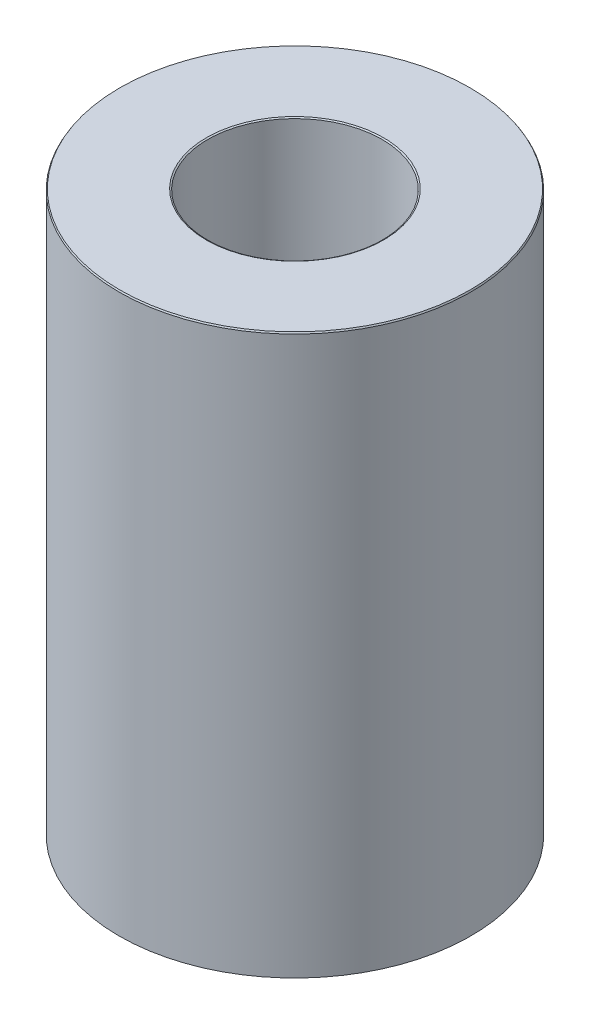
from build123d import *
from OCP.BRepFilletAPI import BRepFilletAPI_MakeChamfer

# Parameters (mm, degrees)
SKETCH1_R           = 57.5
BOSS_EXTRUDE1_DEPTH = 182.991904565
SKETCH2_R           = 28.514841787
CUT_EXTRUDE1_DEPTH  = 201.246191315
CHAMFER1_SIZE       = 0.456871632
CHAMFER1_SIZE2      = 0.267256286


with BuildPart() as part:
    # Sketch1 → Boss-Extrude1 (new body)
    with BuildSketch(Plane(origin=(0, 0, 0), x_dir=(1, 0, 0), z_dir=(0, 1, 0))):
        Circle(SKETCH1_R)
    extrude(amount=BOSS_EXTRUDE1_DEPTH)

    # Sketch2 → Cut-Extrude1 (cut, through all)
    with BuildSketch(Plane(origin=(0, 0, 0), x_dir=(1, 0, 0), z_dir=(0, 1, 0))):
        Circle(SKETCH2_R)
    extrude(amount=CUT_EXTRUDE1_DEPTH, mode=Mode.SUBTRACT)

    # Chamfer1: one chamfer whose edges measure the first distance from different faces: ONE call of the kernel's chamfer builder (chamfer() names one face for all edges)
    chamfer1_edges_1 = [part.edges().sort_by_distance(p)[0] for p in [
        (-28.514841787, 182.991904565, 0),
    ]]
    chamfer1_side_1 = [part.faces().sort_by_distance(p)[0] for p in [
        (-55.873654403, 182.991904565, 0),
    ]]
    chamfer1_edges_2 = [part.edges().sort_by_distance(p)[0] for p in [
        (-28.514841787, 0, 0),
    ]]
    chamfer1_side_2 = [part.faces().sort_by_distance(p)[0] for p in [
        (-28.514841787, 91.495952283, 0),
    ]]
    chamfer1_edges_3 = [part.edges().sort_by_distance(p)[0] for p in [
        (-57.5, 0, 0),
    ]]
    chamfer1_side_3 = [part.faces().sort_by_distance(p)[0] for p in [
        (-55.873654403, 0, 0),
    ]]
    chamfer1_edges_4 = [part.edges().sort_by_distance(p)[0] for p in [
        (-57.5, 182.991904565, 0),
    ]]
    chamfer1_side_4 = [part.faces().sort_by_distance(p)[0] for p in [
        (-57.5, 91.495952283, 0),
    ]]
    chamfer1 = BRepFilletAPI_MakeChamfer(part.part.solid().wrapped)
    for e in chamfer1_edges_1:
        chamfer1.Add(CHAMFER1_SIZE, CHAMFER1_SIZE2, e.wrapped, chamfer1_side_1[0].wrapped)  # the first distance lies on this face
    for e in chamfer1_edges_2:
        chamfer1.Add(CHAMFER1_SIZE, CHAMFER1_SIZE2, e.wrapped, chamfer1_side_2[0].wrapped)  # the first distance lies on this face
    for e in chamfer1_edges_3:
        chamfer1.Add(CHAMFER1_SIZE, CHAMFER1_SIZE2, e.wrapped, chamfer1_side_3[0].wrapped)  # the first distance lies on this face
    for e in chamfer1_edges_4:
        chamfer1.Add(CHAMFER1_SIZE, CHAMFER1_SIZE2, e.wrapped, chamfer1_side_4[0].wrapped)  # the first distance lies on this face
    add(Compound.cast(chamfer1.Shape()), mode=Mode.REPLACE)


solid = part.part
